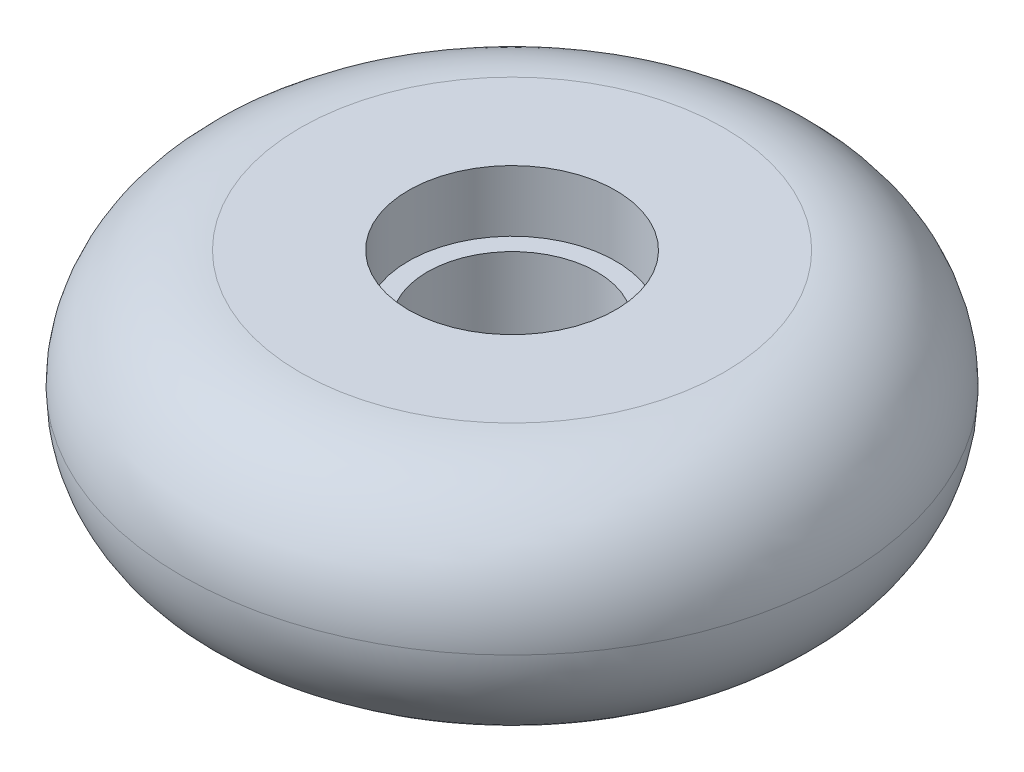
from build123d import *

# Parameters (mm, degrees)
SKETCH1_R           = 35
BOSS_EXTRUDE1_DEPTH = 25
FILLET1_R           = 12.5
SKETCH2_R           = 11
CUT_EXTRUDE1_DEPTH  = 6.5
CUT_EXTRUDE2_START  = -6.5
SKETCH3_R           = 11
CUT_EXTRUDE2_DEPTH  = 6.5
SKETCH4_R           = 9
CUT_EXTRUDE3_DEPTH  = 53.841744861


with BuildPart() as part:
    # Sketch1 → Boss-Extrude1 (new body)
    with BuildSketch(Plane(origin=(0, 0, 0), x_dir=(1, 0, 0), z_dir=(0, 1, 0))):
        with Locations(Location((0, 0, 0), (0, 0, 270))):
            Circle(SKETCH1_R)
    extrude(amount=BOSS_EXTRUDE1_DEPTH)

    # Fillet1
    fillet1_edges = [part.edges().sort_by_distance(p)[0] for p in [
        (0, 0, -35),
        (0, 25, -35),
    ]]
    fillet(fillet1_edges, radius=FILLET1_R - 0.0001)  # a hair under: the kernel refuses the full size

    # Sketch2 → Cut-Extrude1 (cut)
    with BuildSketch(Plane(origin=(0, 25, 0), x_dir=(1, 0, 0), z_dir=(0, 1, 0))):
        with Locations(Location((0, 0, 0), (0, 0, 270))):
            Circle(SKETCH2_R)
    extrude(amount=-CUT_EXTRUDE1_DEPTH, mode=Mode.SUBTRACT)

    # Sketch3 → Cut-Extrude2 (cut)
    with BuildSketch(Plane.XZ.offset(CUT_EXTRUDE2_START)):
        with Locations(Location((0, 0, 0), (0, 0, 90))):
            Circle(SKETCH3_R)
    extrude(amount=CUT_EXTRUDE2_DEPTH, mode=Mode.SUBTRACT)

    # Sketch4 → Cut-Extrude3 (cut, through all)
    with BuildSketch(Plane.XZ.offset(-6.5)):
        with Locations(Location((0, 0, 0), (0, 0, 270))):
            Circle(SKETCH4_R)
    extrude(amount=-CUT_EXTRUDE3_DEPTH, mode=Mode.SUBTRACT)


solid = part.part
